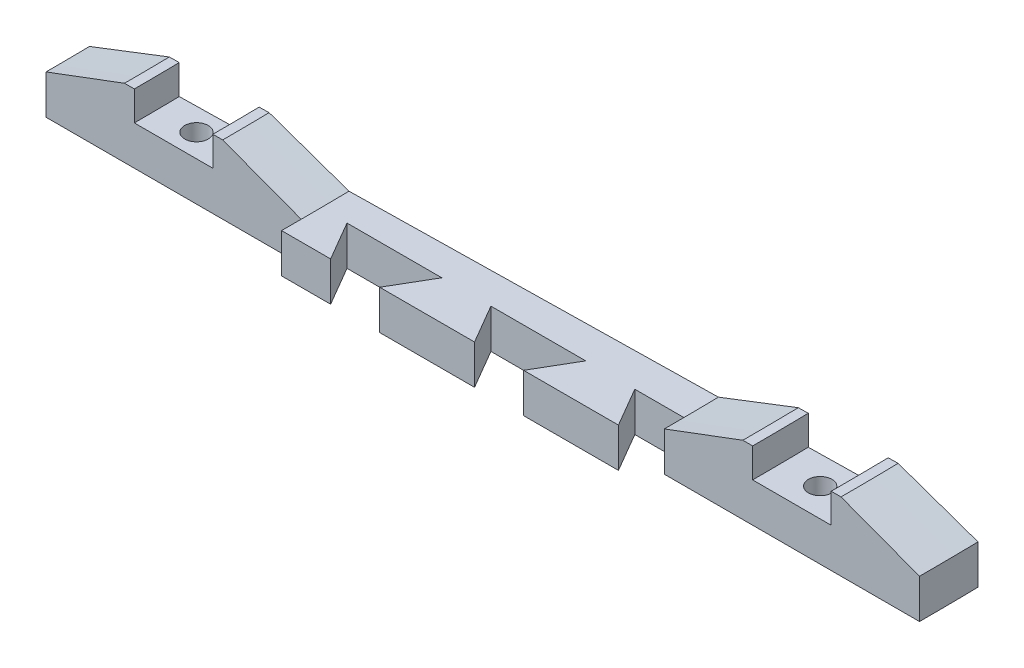
from build123d import *

# Parameters (mm, degrees)
EXTRUDE_1_DEPTH          = 2.5
SKETCH_5_R               = 0.6
CUT_EXTRUDE_1_DEPTH      = 19.036421485
CUT_EXTRUDE_START        = -2
SKETCH_5_3_R             = 1
CUT_EXTRUDE_2_DEPTH      = 1
REVOLVE_1_ANGLE          = 1
SKETCH_9_R               = 0.6
CUT_EXTRUDE_3_DEPTH      = 41.426698916
SKETCH_9_3_R             = 1
CUT_EXTRUDE_4_DEPTH      = 1
SKETCH_10_W              = 73.33326834
SKETCH_10_H              = 28.500223869
CUT_EXTRUDE_5_DEPTH      = 41.528606999
CUT_EXTRUDE_8_DEPTH      = 41.426698916
CUT_EXTRUDE_8_DEPTH_BACK = 41.426698916


with BuildPart() as part:
    # 草图4 → 凸台-拉伸1 (new body)
    with BuildSketch(Plane.XY):
        Polygon((8.5, -1.5), (17.75, -1.5), (17.75, -3.5), (-4.5, -3.5), (-4.5, -1.5), (-0.5, 0), (0, 0), (0, -1.5), (4, -1.5), (4, 0), (4.5, 0), align=None)
    extrude(amount=EXTRUDE_1_DEPTH)

    # 草图5 → 切除-拉伸1 (cut, through all)
    with BuildSketch(Plane(origin=(0, -1.5, 0), x_dir=(1, 0, 0), z_dir=(0, 1, 0))):
        with Locations(Location((2, -1.25, 0), (0, 0, 270))):
            Circle(SKETCH_5_R)
    extrude(amount=-CUT_EXTRUDE_1_DEPTH, mode=Mode.SUBTRACT)

    # 草图5<3> → 切除-拉伸2 (cut)
    with BuildSketch(Plane(origin=(0, -1.5, 0), x_dir=(1, 0, 0), z_dir=(0, 1, 0)).offset(CUT_EXTRUDE_START)):
        with Locations((2, -1.25)):
            Circle(SKETCH_5_3_R)
    extrude(amount=CUT_EXTRUDE_2_DEPTH, mode=Mode.SUBTRACT)

    # 镜向1: part across plane


with BuildPart() as part_1:
    add(part.part)
    add(part.part.mirror(Plane(origin=(17.75, 0, 2.5), x_dir=(0, 0, 1), z_dir=(1, 0, 0))))

    # 草图6 → 旋转1 (revolve)
    with BuildSketch(Plane.XY.offset(2.5)):
        Polygon((0, 0), (-0.5, 0), (-4.5, -1.5), (-4.5, -3.5), (40, -3.5), (40, -1.5), (36, 0), (35.5, 0), (35.5, -1.5), (31.5, -1.5), (31.5, 0), (31, 0), (27, -1.5), (8.5, -1.5), (4.5, 0), (4, 0), (4, -1.5), (0, -1.5), align=None)
    revolve(axis=Axis((-132.25, 94.8535776, 2.5), (0, -1, 0)), revolution_arc=REVOLVE_1_ANGLE)

    # 草图9 → 切除-拉伸3 (cut, through all)
    with BuildSketch(Plane(origin=(0, -1.5, 0), x_dir=(1, 0, 0), z_dir=(0, 1, 0))):
        with Locations(Location((1.994888171, -3.671537391, 0), (0, 0, 180))):
            Circle(SKETCH_9_R)
        with Locations(Location((33.493688748, -3.946423259, 0), (0, 0, 180))):
            Circle(SKETCH_9_R)
    extrude(amount=-CUT_EXTRUDE_3_DEPTH, mode=Mode.SUBTRACT)

    # 草图9<3> → 切除-拉伸4 (cut)
    with BuildSketch(Plane(origin=(0, -1.5, 0), x_dir=(1, 0, 0), z_dir=(0, 1, 0)).offset(CUT_EXTRUDE_START)):
        with Locations((1.994888171, -3.671537391)):
            Circle(SKETCH_9_3_R)
        with Locations((33.493688748, -3.946423259)):
            Circle(SKETCH_9_3_R)
    extrude(amount=CUT_EXTRUDE_4_DEPTH, mode=Mode.SUBTRACT)

    # 镜向2: part across plane


with BuildPart() as part_2:
    add(part_1.part)
    add(part_1.part.mirror(Plane.XY))

    # 草图10 → 切除-拉伸5 (cut, through all)
    with BuildSketch(Plane(origin=(0, 0, 0), x_dir=(-1, 0, 0), z_dir=(0, 0, -1))):
        with Locations((-19.859748979, -4.462825858)):
            Rectangle(SKETCH_10_W, SKETCH_10_H)
    extrude(amount=-CUT_EXTRUDE_5_DEPTH, mode=Mode.SUBTRACT)

    # 草图11 → 切除-拉伸8 (cut, two sides: drawn at the far end of the back side and taken through both)
    with BuildSketch(Plane(origin=(0, -1.5, 0), x_dir=(1, 0, 0), z_dir=(0, 1, 0)).offset(-CUT_EXTRUDE_8_DEPTH_BACK)):
        Polygon((8.5, 2.5), (8.5, 1.5), (11, 1.5), (9.834379916, 3.5), (14.665620084, 3.5), (13.5, 1.5), (18.331240168, 1.5), (17.165620084, 3.5), (21.996860252, 3.5), (20.831240168, 1.5), (25.662480335, 1.5), (24.496860252, 3.5), (26.996860252, 3.5), (27, 2.5), (40, 2.5), (40, 0), (-4.5, 0), (-4.5, 2.5), align=None)
    extrude(amount=CUT_EXTRUDE_8_DEPTH + CUT_EXTRUDE_8_DEPTH_BACK, mode=Mode.SUBTRACT)


solid = part_2.part
